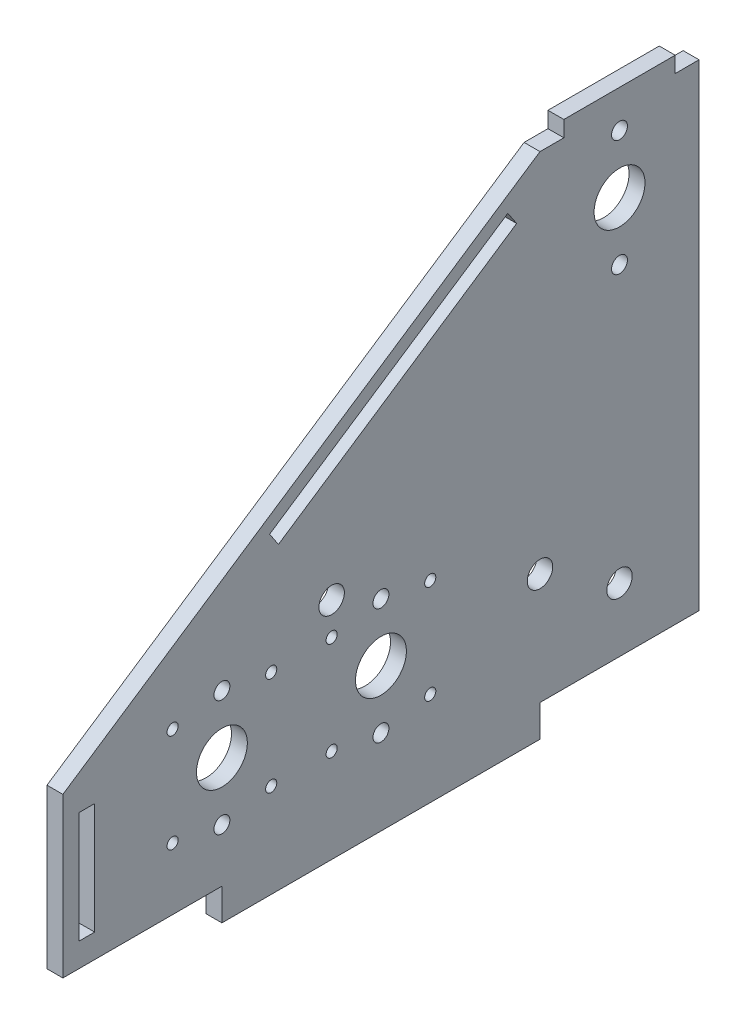
from build123d import *

# Parameters (mm, degrees)
CROQUIS1_R              = 8
CROQUIS1_R_2            = 4
CROQUIS1_R_3            = 2.5
CROQUIS1_R_4            = 1.75
CROQUIS1_W              = 5
CROQUIS1_H              = 35
SALIENTE_EXTRUIR1_DEPTH = 5


with BuildPart() as part:
    # Croquis1 → Saliente-Extruir1 (new body)
    with BuildSketch(Plane(origin=(0, 0, 0), x_dir=(0, 0, -1), z_dir=(1, 0, 0))):
        Polygon((150, 150), (0, 50), (0, 0), (50, 0), (50, -10), (150, -10), (150, 0), (200, 0), (200, 150), (192.5, 150), (192.5, 155), (157.5, 155), (157.5, 150), align=None)
        with Locations((175, 125)):
            Circle(CROQUIS1_R, mode=Mode.SUBTRACT)
        with Locations((175, 20)):
            Circle(CROQUIS1_R_2, mode=Mode.SUBTRACT)
        with Locations((150, 35)):
            Circle(CROQUIS1_R_2, mode=Mode.SUBTRACT)
        with Locations((175, 143.25)):
            Circle(CROQUIS1_R_3, mode=Mode.SUBTRACT)
        with Locations((175, 106.75)):
            Circle(CROQUIS1_R_3, mode=Mode.SUBTRACT)
        with Locations((100, 35)):
            Circle(CROQUIS1_R, mode=Mode.SUBTRACT)
        with Locations((84.5, 60.685599078)):
            Circle(CROQUIS1_R_2, mode=Mode.SUBTRACT)
        with Locations((100, 53.25)):
            Circle(CROQUIS1_R_3, mode=Mode.SUBTRACT)
        with Locations((100, 16.75)):
            Circle(CROQUIS1_R_3, mode=Mode.SUBTRACT)
        with Locations((84.5, 50.5)):
            Circle(CROQUIS1_R_4, mode=Mode.SUBTRACT)
        with Locations((115.5, 50.5)):
            Circle(CROQUIS1_R_4, mode=Mode.SUBTRACT)
        with Locations((115.5, 19.5)):
            Circle(CROQUIS1_R_4, mode=Mode.SUBTRACT)
        with Locations((84.5, 19.5)):
            Circle(CROQUIS1_R_4, mode=Mode.SUBTRACT)
        with Locations((50, 35)):
            Circle(CROQUIS1_R, mode=Mode.SUBTRACT)
        with Locations((50, 53.25)):
            Circle(CROQUIS1_R_3, mode=Mode.SUBTRACT)
        with Locations((50, 16.75)):
            Circle(CROQUIS1_R_3, mode=Mode.SUBTRACT)
        with Locations((34.5, 50.5)):
            Circle(CROQUIS1_R_4, mode=Mode.SUBTRACT)
        with Locations((65.5, 50.5)):
            Circle(CROQUIS1_R_4, mode=Mode.SUBTRACT)
        with Locations((65.5, 19.5)):
            Circle(CROQUIS1_R_4, mode=Mode.SUBTRACT)
        with Locations((34.5, 19.5)):
            Circle(CROQUIS1_R_4, mode=Mode.SUBTRACT)
        Polygon((65, 88.333333333), (139.88452649, 138.256350994), (142.658027472, 134.096099522), (67.773500981, 84.173081862), align=None, mode=Mode.SUBTRACT)
        with Locations((7.5, 25)):
            Rectangle(CROQUIS1_W, CROQUIS1_H, mode=Mode.SUBTRACT)
    extrude(amount=SALIENTE_EXTRUIR1_DEPTH)


solid = part.part
